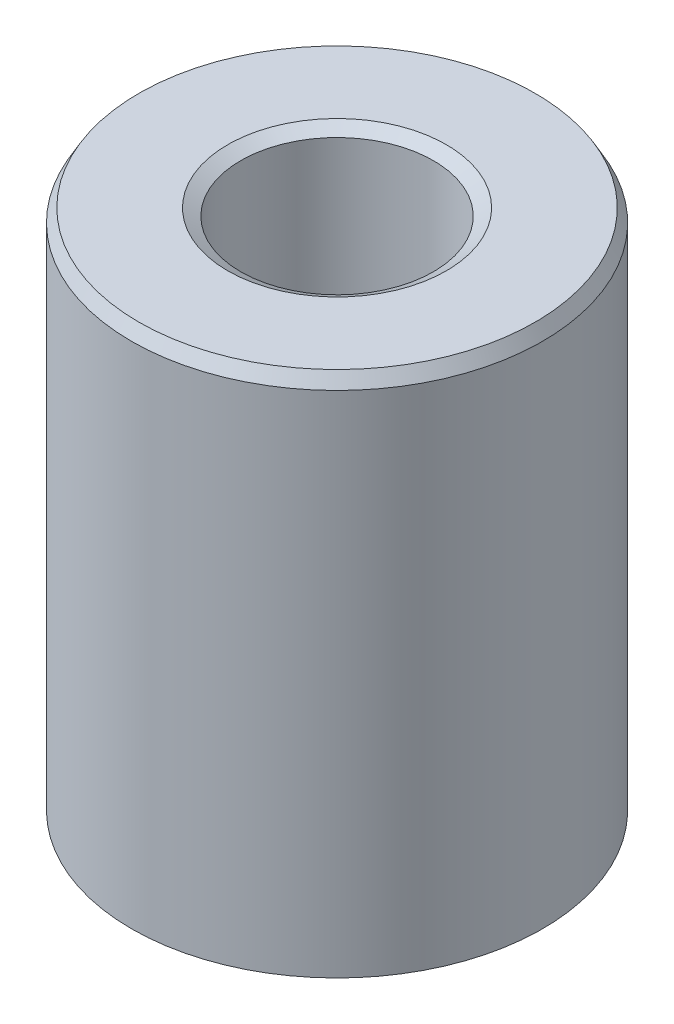
from build123d import *
from OCP.BRepFilletAPI import BRepFilletAPI_MakeChamfer

# Parameters (mm, degrees)
SKETCH1_R           = 10
BOSS_EXTRUDE1_DEPTH = 25.747449574
SKETCH2_R           = 4.688713347
CUT_EXTRUDE1_DEPTH  = 30.375689942
CHAMFER1_SIZE       = 0.631012441
CHAMFER1_SIZE2      = 0.355804082


with BuildPart() as part:
    # Sketch1 → Boss-Extrude1 (new body)
    with BuildSketch(Plane(origin=(0, 0, 0), x_dir=(1, 0, 0), z_dir=(0, 1, 0))):
        Circle(SKETCH1_R)
    extrude(amount=BOSS_EXTRUDE1_DEPTH)

    # Sketch2 → Cut-Extrude1 (cut, through all)
    with BuildSketch(Plane(origin=(0, 0, 0), x_dir=(1, 0, 0), z_dir=(0, 1, 0))):
        Circle(SKETCH2_R)
    extrude(amount=CUT_EXTRUDE1_DEPTH, mode=Mode.SUBTRACT)

    # Chamfer1: one chamfer whose edges measure the first distance from different faces: ONE call of the kernel's chamfer builder (chamfer() names one face for all edges)
    chamfer1_edges_1 = [part.edges().sort_by_distance(p)[0] for p in [
        (-4.688713347, 25.747449574, 0),
    ]]
    chamfer1_side_1 = [part.faces().sort_by_distance(p)[0] for p in [
        (-9.717157288, 25.747449574, 0),
    ]]
    chamfer1_edges_2 = [part.edges().sort_by_distance(p)[0] for p in [
        (-4.688713347, 0, 0),
    ]]
    chamfer1_side_2 = [part.faces().sort_by_distance(p)[0] for p in [
        (-4.688713347, 12.873724787, 0),
    ]]
    chamfer1_edges_3 = [part.edges().sort_by_distance(p)[0] for p in [
        (-10, 0, 0),
    ]]
    chamfer1_side_3 = [part.faces().sort_by_distance(p)[0] for p in [
        (-9.717157288, 0, 0),
    ]]
    chamfer1_edges_4 = [part.edges().sort_by_distance(p)[0] for p in [
        (-10, 25.747449574, 0),
    ]]
    chamfer1_side_4 = [part.faces().sort_by_distance(p)[0] for p in [
        (-10, 12.873724787, 0),
    ]]
    chamfer1 = BRepFilletAPI_MakeChamfer(part.part.solid().wrapped)
    for e in chamfer1_edges_1:
        chamfer1.Add(CHAMFER1_SIZE, CHAMFER1_SIZE2, e.wrapped, chamfer1_side_1[0].wrapped)  # the first distance lies on this face
    for e in chamfer1_edges_2:
        chamfer1.Add(CHAMFER1_SIZE, CHAMFER1_SIZE2, e.wrapped, chamfer1_side_2[0].wrapped)  # the first distance lies on this face
    for e in chamfer1_edges_3:
        chamfer1.Add(CHAMFER1_SIZE, CHAMFER1_SIZE2, e.wrapped, chamfer1_side_3[0].wrapped)  # the first distance lies on this face
    for e in chamfer1_edges_4:
        chamfer1.Add(CHAMFER1_SIZE, CHAMFER1_SIZE2, e.wrapped, chamfer1_side_4[0].wrapped)  # the first distance lies on this face
    add(Compound.cast(chamfer1.Shape()), mode=Mode.REPLACE)


solid = part.part
